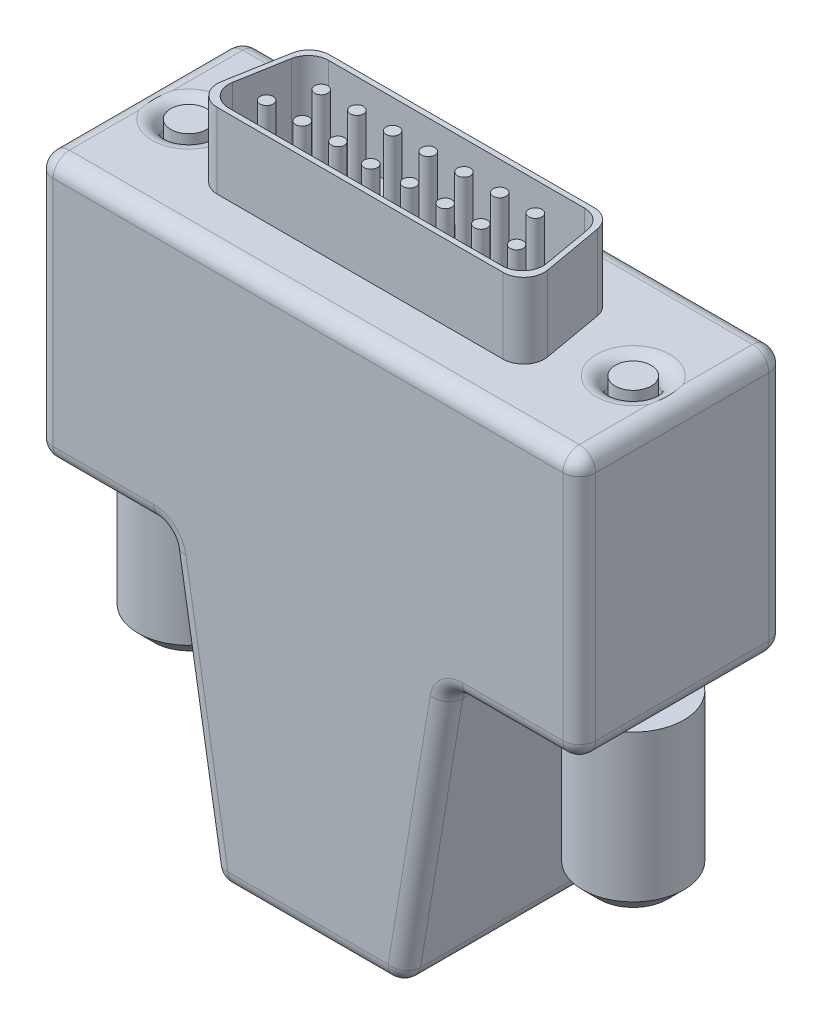
from build123d import *

# Parameters (mm, degrees)
BASE_EXTRUDE_DEPTH  = 8.001
SKETCH10_R          = 1.5875
CUT_EXTRUDE1_DEPTH  = 49.039082516
FILLET2_R           = 1.27
SKETCH13_R          = 2.794
CUT_EXTRUDE4_DEPTH  = 2.54
SKETCH14_R          = 2.54
BOSS_EXTRUDE1_DEPTH = 2.54
SKETCH16_R          = 2.54
BOSS_EXTRUDE2_DEPTH = 2.54
SKETCH17_R          = 1.397
BOSS_EXTRUDE3_DEPTH = 3.81
SKETCH15_R          = 3.937
BOSS_EXTRUDE4_DEPTH = 12.7
CHAMFER1_SIZE       = 1.27
SKETCH18_R          = 1.905
CUT_EXTRUDE5_DEPTH  = 2.54
BOSS_EXTRUDE5_DEPTH = 5.842
SKETCH20_R          = 0.508
BOSS_EXTRUDE6_DEPTH = 5.715
BOSS_EXTRUDE7_START = 16.129
SKETCH23_R          = 1.397
BOSS_EXTRUDE7_DEPTH = 16.129


with BuildPart() as part:
    # Sketch1 → Base-Extrude (new, symmetric)
    with BuildSketch(Plane.XY):
        Polygon((-21.082, 21.209), (21.082, 21.209), (21.082, 0.635), (10.922, 0.635), (7.3025, -21.209), (-7.3025, -21.209), (-10.922, 0.635), (-21.082, 0.635), align=None)
    extrude(amount=BASE_EXTRUDE_DEPTH, both=True)

    # Sketch10 → Cut-Extrude1 (cut, through all)
    with BuildSketch(Plane(origin=(0, 21.209, 0), x_dir=(-1, 0, 0), z_dir=(0, 1, 0))):
        with Locations((17.272, 0)):
            Circle(SKETCH10_R)
        with Locations((-17.272, 0)):
            Circle(SKETCH10_R)
    extrude(amount=-CUT_EXTRUDE1_DEPTH, mode=Mode.SUBTRACT)

    # Fillet2
    # the kernel refuses this fillet: 1.27 mm, written as the material it adds along each edge
    with BuildSketch(Plane(origin=(10.922, 0.635, 8.001), x_dir=(1, 0, 0), z_dir=(0, 0, -1)), Plane(origin=(-10.922, 0.635, -8.001), x_dir=(-1, 0, 0), z_dir=(0, 0, 1))) as fillet2_piece_1:
        with BuildLine():
            CenterArc((FILLET2_R * 0.847937229927, FILLET2_R), FILLET2_R, 189.408295086, 80.591704914)
            Line((-FILLET2_R * 0.138611275568, FILLET2_R * 0.836531206938), (0, 0))
            Line((0, 0), (FILLET2_R * 0.847937229927, 0))
        make_face()
    extrude(amount=16.002)
    # the kernel refuses this fillet: 1.27 mm, written as the material it takes off along each edge
    with BuildSketch(Plane(origin=(-19.812, 19.939, 6.731), x_dir=(-1, 0, 0), z_dir=(0, 1, 0))) as fillet2_2_piece_1_section:
        Polygon((0, 0), (FILLET2_R, 0), (FILLET2_R, FILLET2_R), (0, FILLET2_R), align=None)
    fillet2_2_piece_1 = extrude(amount=FILLET2_R, mode=Mode.PRIVATE)
    fillet2_2_piece_1 = fillet2_2_piece_1 - Plane(origin=(-19.812, 19.939, 6.731), x_dir=(0.7071067811865475, 0, -0.7071067811865475), z_dir=(0, 1, 0)) * Sphere(FILLET2_R, mode=Mode.PRIVATE)
    add(fillet2_2_piece_1, mode=Mode.SUBTRACT)
    with BuildSketch(Plane(origin=(19.812, 19.939, 6.731), x_dir=(0, 0, 1), z_dir=(0, 1, 0))) as fillet2_2_piece_2_section:
        Polygon((0, 0), (FILLET2_R, 0), (FILLET2_R, FILLET2_R), (0, FILLET2_R), align=None)
    fillet2_2_piece_2 = extrude(amount=FILLET2_R, mode=Mode.PRIVATE)
    fillet2_2_piece_2 = fillet2_2_piece_2 - Plane(origin=(19.812, 19.939, 6.731), x_dir=(-0.7071067811865475, 0, -0.7071067811865475), z_dir=(0, 1, 0)) * Sphere(FILLET2_R, mode=Mode.PRIVATE)
    add(fillet2_2_piece_2, mode=Mode.SUBTRACT)
    with BuildSketch(Plane(origin=(19.812, 19.939, -6.731), x_dir=(0, 0, -1), z_dir=(0, 1, 0))) as fillet2_2_piece_3_section:
        Polygon((0, 0), (FILLET2_R, 0), (FILLET2_R, -FILLET2_R), (0, -FILLET2_R), align=None)
    fillet2_2_piece_3 = extrude(amount=FILLET2_R, mode=Mode.PRIVATE)
    fillet2_2_piece_3 = fillet2_2_piece_3 - Plane(origin=(19.812, 19.939, -6.731), x_dir=(-0.7071067811865475, 0, 0.7071067811865475), z_dir=(0, 1, 0)) * Sphere(FILLET2_R, mode=Mode.PRIVATE)
    add(fillet2_2_piece_3, mode=Mode.SUBTRACT)
    with BuildSketch(Plane(origin=(19.812, 1.905, -6.731), x_dir=(0, 0, -1), z_dir=(0, -1, 0))) as fillet2_2_piece_4_section:
        Polygon((0, 0), (FILLET2_R, 0), (FILLET2_R, FILLET2_R), (0, FILLET2_R), align=None)
    fillet2_2_piece_4 = extrude(amount=FILLET2_R, mode=Mode.PRIVATE)
    fillet2_2_piece_4 = fillet2_2_piece_4 - Plane(origin=(19.812, 1.905, -6.731), x_dir=(-0.7071067811865475, 0, 0.7071067811865475), z_dir=(0, -1, 0)) * Sphere(FILLET2_R, mode=Mode.PRIVATE)
    add(fillet2_2_piece_4, mode=Mode.SUBTRACT)
    with BuildSketch(Plane(origin=(-19.812, 1.905, 6.731), x_dir=(0, 0, 1), z_dir=(-1, 0, 0))) as fillet2_2_piece_5_section:
        Polygon((0, 0), (FILLET2_R, 0), (FILLET2_R, -FILLET2_R), (0, -FILLET2_R), align=None)
    fillet2_2_piece_5 = extrude(amount=FILLET2_R, mode=Mode.PRIVATE)
    fillet2_2_piece_5 = fillet2_2_piece_5 - Plane(origin=(-19.812, 1.905, 6.731), x_dir=(0, 0.7071067811865475, -0.7071067811865475), z_dir=(-1, 0, 0)) * Sphere(FILLET2_R, mode=Mode.PRIVATE)
    add(fillet2_2_piece_5, mode=Mode.SUBTRACT)
    with BuildSketch(Plane(origin=(6.225619718, -19.939, 6.731), x_dir=(0.9865485054952676, -0.1634687930617159, 0), z_dir=(0, 0, 1))) as fillet2_2_piece_6_section:
        Polygon((0, 0), (FILLET2_R, 0), (FILLET2_R, -FILLET2_R * 0.847937229927), (FILLET2_R * 0.163468793062, -FILLET2_R * 0.986548505495), align=None)
    fillet2_2_piece_6 = extrude(amount=FILLET2_R, mode=Mode.PRIVATE)
    fillet2_2_piece_6 = fillet2_2_piece_6 - Plane(origin=(6.225619718, -19.939, 6.731), x_dir=(-0.6467345695640075, 0.7627151476998855, 0), z_dir=(0, 0, 1)) * Sphere(FILLET2_R, mode=Mode.PRIVATE)
    add(fillet2_2_piece_6, mode=Mode.SUBTRACT)
    with BuildSketch(Plane(origin=(6.225619718, -19.939, -6.731), x_dir=(0.9865485054952676, -0.1634687930617159, 0), z_dir=(0, 0, -1))) as fillet2_2_piece_7_section:
        Polygon((0, 0), (FILLET2_R, 0), (FILLET2_R, FILLET2_R * 0.847937229927), (FILLET2_R * 0.163468793062, FILLET2_R * 0.986548505495), align=None)
    fillet2_2_piece_7 = extrude(amount=FILLET2_R, mode=Mode.PRIVATE)
    fillet2_2_piece_7 = fillet2_2_piece_7 - Plane(origin=(6.225619718, -19.939, -6.731), x_dir=(-0.6467345695640075, 0.7627151476998855, 0), z_dir=(0, 0, -1)) * Sphere(FILLET2_R, mode=Mode.PRIVATE)
    add(fillet2_2_piece_7, mode=Mode.SUBTRACT)
    with BuildSketch(Plane(origin=(-6.225619718, -19.939, 6.731), x_dir=(0, -1, 0), z_dir=(0, 0, 1))) as fillet2_2_piece_8_section:
        Polygon((0, 0), (FILLET2_R, 0), (FILLET2_R, -FILLET2_R * 0.847937229927), (FILLET2_R * 0.163468793062, -FILLET2_R * 0.986548505495), align=None)
    fillet2_2_piece_8 = extrude(amount=FILLET2_R, mode=Mode.PRIVATE)
    fillet2_2_piece_8 = fillet2_2_piece_8 - Plane(origin=(-6.225619718, -19.939, 6.731), x_dir=(0.6467345695640078, 0.7627151476998854, 0), z_dir=(0, 0, 1)) * Sphere(FILLET2_R, mode=Mode.PRIVATE)
    add(fillet2_2_piece_8, mode=Mode.SUBTRACT)
    with BuildSketch(Plane(origin=(-6.225619718, -19.939, -6.731), x_dir=(0, -1, 0), z_dir=(0, 0, -1))) as fillet2_2_piece_9_section:
        Polygon((0, 0), (FILLET2_R, 0), (FILLET2_R, FILLET2_R * 0.847937229927), (FILLET2_R * 0.163468793062, FILLET2_R * 0.986548505495), align=None)
    fillet2_2_piece_9 = extrude(amount=FILLET2_R, mode=Mode.PRIVATE)
    fillet2_2_piece_9 = fillet2_2_piece_9 - Plane(origin=(-6.225619718, -19.939, -6.731), x_dir=(0.6467345695640078, 0.7627151476998854, 0), z_dir=(0, 0, -1)) * Sphere(FILLET2_R, mode=Mode.PRIVATE)
    add(fillet2_2_piece_9, mode=Mode.SUBTRACT)
    with BuildSketch(Plane(origin=(-19.812, 1.905, -6.731), x_dir=(0, 0, -1), z_dir=(-1, 0, 0))) as fillet2_2_piece_10_section:
        Polygon((0, 0), (FILLET2_R, 0), (FILLET2_R, FILLET2_R), (0, FILLET2_R), align=None)
    fillet2_2_piece_10 = extrude(amount=FILLET2_R, mode=Mode.PRIVATE)
    fillet2_2_piece_10 = fillet2_2_piece_10 - Plane(origin=(-19.812, 1.905, -6.731), x_dir=(0, 0.7071067811865475, 0.7071067811865475), z_dir=(-1, 0, 0)) * Sphere(FILLET2_R, mode=Mode.PRIVATE)
    add(fillet2_2_piece_10, mode=Mode.SUBTRACT)
    with BuildSketch(Plane(origin=(-19.812, 19.939, -6.731), x_dir=(-1, 0, 0), z_dir=(0, 1, 0))) as fillet2_2_piece_11_section:
        Polygon((0, 0), (FILLET2_R, 0), (FILLET2_R, -FILLET2_R), (0, -FILLET2_R), align=None)
    fillet2_2_piece_11 = extrude(amount=FILLET2_R, mode=Mode.PRIVATE)
    fillet2_2_piece_11 = fillet2_2_piece_11 - Plane(origin=(-19.812, 19.939, -6.731), x_dir=(0.7071067811865475, 0, 0.7071067811865475), z_dir=(0, 1, 0)) * Sphere(FILLET2_R, mode=Mode.PRIVATE)
    add(fillet2_2_piece_11, mode=Mode.SUBTRACT)
    with BuildSketch(Plane(origin=(19.812, 1.905, 6.731), x_dir=(0, 0, 1), z_dir=(0, -1, 0))) as fillet2_2_piece_12_section:
        Polygon((0, 0), (FILLET2_R, 0), (FILLET2_R, -FILLET2_R), (0, -FILLET2_R), align=None)
    fillet2_2_piece_12 = extrude(amount=FILLET2_R, mode=Mode.PRIVATE)
    fillet2_2_piece_12 = fillet2_2_piece_12 - Plane(origin=(19.812, 1.905, 6.731), x_dir=(-0.7071067811865475, 0, -0.7071067811865475), z_dir=(0, -1, 0)) * Sphere(FILLET2_R, mode=Mode.PRIVATE)
    add(fillet2_2_piece_12, mode=Mode.SUBTRACT)
    with BuildSketch(Plane(origin=(-19.812, 21.209, 8.001), x_dir=(0, 0, -1), z_dir=(1, 0, 0))) as fillet2_2_piece_13:
        with BuildLine():
            CenterArc((FILLET2_R, -FILLET2_R), FILLET2_R, 90, 90)
            Line((0, -FILLET2_R), (0, 0))
            Line((0, 0), (FILLET2_R, 0))
        make_face()
    extrude(amount=39.624, mode=Mode.SUBTRACT)
    with BuildSketch(Plane(origin=(21.082, 19.939, -8.001), x_dir=(-1, 0, 0), z_dir=(0, -1, 0)), Plane(origin=(-21.082, 1.905, 8.001), x_dir=(0, 0, -1), z_dir=(0, 1, 0))) as fillet2_2_piece_14:
        with BuildLine():
            CenterArc((FILLET2_R, -FILLET2_R), FILLET2_R, 90, 90)
            Line((0, -FILLET2_R), (0, 0))
            Line((0, 0), (FILLET2_R, 0))
        make_face()
    extrude(amount=18.034, mode=Mode.SUBTRACT)
    with BuildSketch(Plane(origin=(19.812, 0.635, -8.001), x_dir=(0, 1, 0), z_dir=(-1, 0, 0)), Plane(origin=(-11.998880282, 0.635, -8.001), x_dir=(0, 1, 0), z_dir=(-1, 0, 0))) as fillet2_2_piece_15:
        with BuildLine():
            CenterArc((FILLET2_R, -FILLET2_R), FILLET2_R, 90, 90)
            Line((0, -FILLET2_R), (0, 0))
            Line((0, 0), (FILLET2_R, 0))
        make_face()
    extrude(amount=7.813119718, mode=Mode.SUBTRACT)
    with BuildSketch(Plane(origin=(7.3025, -21.209, 6.731), x_dir=(0.16346879306171674, 0.9865485054952674, 0), z_dir=(0, 0, -1)), Plane(origin=(-7.3025, -21.209, 6.731), x_dir=(1, 0, 0), z_dir=(0, 0, -1))) as fillet2_2_piece_16:
        with BuildLine():
            CenterArc((FILLET2_R * 0.847937229927, -FILLET2_R), FILLET2_R, 90, 80.591704914)
            Line((-FILLET2_R * 0.138611275568, -FILLET2_R * 0.836531206938), (0, 0))
            Line((0, 0), (FILLET2_R * 0.847937229927, 0))
        make_face()
    extrude(amount=13.462, mode=Mode.SUBTRACT)
    with BuildSketch(Plane(origin=(-21.082, 0.635, -6.731), x_dir=(0, 1, 0), z_dir=(0, 0, 1)), Plane(origin=(-21.082, 21.209, -6.731), x_dir=(1, 0, 0), z_dir=(0, 0, 1)), Plane(origin=(21.082, 21.209, 6.731), x_dir=(-1, 0, 0), z_dir=(0, 0, -1)), Plane(origin=(21.082, 0.635, 6.731), x_dir=(0, 1, 0), z_dir=(0, 0, -1))) as fillet2_2_piece_17:
        with BuildLine():
            CenterArc((FILLET2_R, -FILLET2_R), FILLET2_R, 90, 90)
            Line((0, -FILLET2_R), (0, 0))
            Line((0, 0), (FILLET2_R, 0))
        make_face()
    extrude(amount=13.462, mode=Mode.SUBTRACT)
    with BuildSketch(Plane(origin=(-11.998880282, 0.635, 8.001), x_dir=(0, 1, 0), z_dir=(-1, 0, 0)), Plane(origin=(19.812, 0.635, 8.001), x_dir=(0, 1, 0), z_dir=(-1, 0, 0))) as fillet2_2_piece_18:
        with BuildLine():
            CenterArc((FILLET2_R, FILLET2_R), FILLET2_R, 180, 90)
            Line((0, FILLET2_R), (0, 0))
            Line((0, 0), (FILLET2_R, 0))
        make_face()
    extrude(amount=7.813119718, mode=Mode.SUBTRACT)
    with BuildSketch(Plane(origin=(-7.47853632, -20.146605367, 8.001), x_dir=(0.9865485054952676, 0.16346879306171572, 0), z_dir=(-0.16346879306171572, 0.9865485054952676, 0)), Plane(origin=(10.74596368, -0.427394633, 8.001), x_dir=(-0.9865485054952676, 0.16346879306171594, 0), z_dir=(-0.1634687930617159, -0.9865485054952676, 0))) as fillet2_2_piece_19:
        with BuildLine():
            CenterArc((FILLET2_R, FILLET2_R), FILLET2_R, 180, 90)
            Line((0, FILLET2_R), (0, 0))
            Line((0, 0), (FILLET2_R, 0))
        make_face()
    extrude(amount=19.988080287, mode=Mode.SUBTRACT)
    with BuildSketch(Plane(origin=(6.225619718, -21.209, 8.001), x_dir=(0, 1, 0), z_dir=(-1, 0, 0))) as fillet2_2_piece_20:
        with BuildLine():
            CenterArc((FILLET2_R, FILLET2_R), FILLET2_R, 180, 90)
            Line((0, FILLET2_R), (0, 0))
            Line((0, 0), (FILLET2_R, 0))
        make_face()
    extrude(amount=12.451239436, mode=Mode.SUBTRACT)
    with BuildSketch(Plane(origin=(-17.272, 0.635, 0), x_dir=(-1, 0, 0), z_dir=(0, 0, -1))) as fillet2_2_piece_21:
        with BuildLine():
            CenterArc((1.5875 + FILLET2_R, FILLET2_R), FILLET2_R, 180, 90)
            Line((1.5875 + FILLET2_R, 0), (1.5875, 0))
            Line((1.5875, 0), (1.5875, FILLET2_R))
        make_face()
    revolve(axis=Axis((-17.272, 0.635, 0), (0, 1, 0)), mode=Mode.SUBTRACT)
    with BuildSketch(Plane(origin=(-17.272, 21.209, 0), x_dir=(-1, 0, 0), z_dir=(0, 0, -1))) as fillet2_2_piece_22:
        with BuildLine():
            CenterArc((1.5875 + FILLET2_R, -FILLET2_R), FILLET2_R, 90, 90)
            Line((1.5875, -FILLET2_R), (1.5875, 0))
            Line((1.5875, 0), (1.5875 + FILLET2_R, 0))
        make_face()
    revolve(axis=Axis((-17.272, 21.209, 0), (0, 1, 0)), mode=Mode.SUBTRACT)
    with BuildSketch(Plane(origin=(17.272, 0.635, 0), x_dir=(-1, 0, 0), z_dir=(0, 0, -1))) as fillet2_2_piece_23:
        with BuildLine():
            CenterArc((1.5875 + FILLET2_R, FILLET2_R), FILLET2_R, 180, 90)
            Line((1.5875 + FILLET2_R, 0), (1.5875, 0))
            Line((1.5875, 0), (1.5875, FILLET2_R))
        make_face()
    revolve(axis=Axis((17.272, 0.635, 0), (0, 1, 0)), mode=Mode.SUBTRACT)
    with BuildSketch(Plane(origin=(17.272, 21.209, 0), x_dir=(-1, 0, 0), z_dir=(0, 0, -1))) as fillet2_2_piece_24:
        with BuildLine():
            CenterArc((1.5875 + FILLET2_R, -FILLET2_R), FILLET2_R, 90, 90)
            Line((1.5875, -FILLET2_R), (1.5875, 0))
            Line((1.5875, 0), (1.5875 + FILLET2_R, 0))
        make_face()
    revolve(axis=Axis((17.272, 21.209, 0), (0, 1, 0)), mode=Mode.SUBTRACT)
    with BuildSketch(Plane(origin=(21.082, 19.939, 8.001), x_dir=(-1, 0, 0), z_dir=(0, -1, 0)), Plane(origin=(-21.082, 1.905, -8.001), x_dir=(0, 0, 1), z_dir=(0, 1, 0))) as fillet2_2_piece_25:
        with BuildLine():
            CenterArc((FILLET2_R, FILLET2_R), FILLET2_R, 180, 90)
            Line((0, FILLET2_R), (0, 0))
            Line((0, 0), (FILLET2_R, 0))
        make_face()
    extrude(amount=18.034, mode=Mode.SUBTRACT)
    with BuildSketch(Plane(origin=(10.74596368, -0.427394633, -8.001), x_dir=(-0.9865485054952676, 0.16346879306171594, 0), z_dir=(-0.1634687930617159, -0.9865485054952676, 0)), Plane(origin=(-7.47853632, -20.146605367, -8.001), x_dir=(0.9865485054952676, 0.16346879306171572, 0), z_dir=(-0.16346879306171572, 0.9865485054952676, 0))) as fillet2_2_piece_26:
        with BuildLine():
            CenterArc((FILLET2_R, -FILLET2_R), FILLET2_R, 90, 90)
            Line((0, -FILLET2_R), (0, 0))
            Line((0, 0), (FILLET2_R, 0))
        make_face()
    extrude(amount=19.988080287, mode=Mode.SUBTRACT)
    with BuildSketch(Plane(origin=(6.225619718, -21.209, -8.001), x_dir=(0, 1, 0), z_dir=(-1, 0, 0))) as fillet2_2_piece_27:
        with BuildLine():
            CenterArc((FILLET2_R, -FILLET2_R), FILLET2_R, 90, 90)
            Line((0, -FILLET2_R), (0, 0))
            Line((0, 0), (FILLET2_R, 0))
        make_face()
    extrude(amount=12.451239436, mode=Mode.SUBTRACT)
    with BuildSketch(Plane(origin=(-19.812, 21.209, -8.001), x_dir=(0, 0, 1), z_dir=(1, 0, 0))) as fillet2_2_piece_28:
        with BuildLine():
            CenterArc((FILLET2_R, FILLET2_R), FILLET2_R, 180, 90)
            Line((0, FILLET2_R), (0, 0))
            Line((0, 0), (FILLET2_R, 0))
        make_face()
    extrude(amount=39.624, mode=Mode.SUBTRACT)
    with BuildSketch(Plane(origin=(-11.998880282, -0.635, -8.001), x_dir=(0, 1, 0), z_dir=(-1, 0, 0))) as fillet2_2_piece_29:
        with BuildLine():
            CenterArc((1.27 + FILLET2_R, -FILLET2_R), FILLET2_R, 90, 90)
            Line((1.27, -FILLET2_R), (1.27, 0))
            Line((1.27, 0), (1.27 + FILLET2_R, 0))
        make_face()
    revolve(axis=Axis((-11.998880282, -0.635, -8.001), (0, 0, -1)), revolution_arc=80.591704914, mode=Mode.SUBTRACT)
    with BuildSketch(Plane(origin=(11.998880282, -0.635, -8.001), x_dir=(0, 1, 0), z_dir=(1, 0, 0))) as fillet2_2_piece_30:
        with BuildLine():
            CenterArc((1.27 + FILLET2_R, FILLET2_R), FILLET2_R, 180, 90)
            Line((1.27, FILLET2_R), (1.27, 0))
            Line((1.27, 0), (1.27 + FILLET2_R, 0))
        make_face()
    revolve(axis=Axis((11.998880282, -0.635, -8.001), (0, 0, 1)), revolution_arc=80.591704914, mode=Mode.SUBTRACT)
    with BuildSketch(Plane(origin=(11.998880282, -0.635, 8.001), x_dir=(0, 1, 0), z_dir=(1, 0, 0))) as fillet2_2_piece_31:
        with BuildLine():
            CenterArc((1.27 + FILLET2_R, -FILLET2_R), FILLET2_R, 90, 90)
            Line((1.27, -FILLET2_R), (1.27, 0))
            Line((1.27, 0), (1.27 + FILLET2_R, 0))
        make_face()
    revolve(axis=Axis((11.998880282, -0.635, 8.001), (0, 0, 1)), revolution_arc=80.591704914, mode=Mode.SUBTRACT)
    with BuildSketch(Plane(origin=(-11.998880282, -0.635, 8.001), x_dir=(0, 1, 0), z_dir=(-1, 0, 0))) as fillet2_2_piece_32:
        with BuildLine():
            CenterArc((1.27 + FILLET2_R, FILLET2_R), FILLET2_R, 180, 90)
            Line((1.27, FILLET2_R), (1.27, 0))
            Line((1.27, 0), (1.27 + FILLET2_R, 0))
        make_face()
    revolve(axis=Axis((-11.998880282, -0.635, 8.001), (0, 0, -1)), revolution_arc=80.591704914, mode=Mode.SUBTRACT)

    # Sketch13 → Cut-Extrude4 (cut)
    with BuildSketch(Plane(origin=(0, -21.209, 0), x_dir=(-1, 0, 0), z_dir=(0, 1, 0))):
        with Locations(Location((0, 0, 0), (0, 0, 90))):
            Circle(SKETCH13_R)
    extrude(amount=CUT_EXTRUDE4_DEPTH, mode=Mode.SUBTRACT)

    # Sketch14 → Boss-Extrude1 (add)
    with BuildSketch(Plane.XZ.offset(18.669)):
        with Locations(Location((0, 0, 0), (0, 0, 90))):
            Circle(SKETCH14_R)
    extrude(amount=BOSS_EXTRUDE1_DEPTH)

    # Sketch16 → Boss-Extrude2 (add)
    with BuildSketch(Plane(origin=(0, 5.08, 0), x_dir=(-1, 0, 0), z_dir=(0, 1, 0))):
        with Locations((-17.272, 0)):
            Circle(SKETCH16_R)
        with Locations((17.272, 0)):
            Circle(SKETCH16_R)
    extrude(amount=-BOSS_EXTRUDE2_DEPTH)

    # Sketch17 → Boss-Extrude3 (add)
    with BuildSketch(Plane.XZ.offset(-2.54)):
        with Locations(Location((17.272, 0, 0), (0, 0, 90))):
            Circle(SKETCH17_R)
        with Locations(Location((-17.272, 0, 0), (0, 0, 90))):
            Circle(SKETCH17_R)
    extrude(amount=BOSS_EXTRUDE3_DEPTH)

    # Sketch15 → Boss-Extrude4 (add)
    with BuildSketch(Plane(origin=(0, 0, 0), x_dir=(1, 0, 0), z_dir=(0, 1, 0))):
        with Locations(Location((17.272, 0, 0), (0, 0, 270))):
            Circle(SKETCH15_R)
        with Locations(Location((-17.272, 0, 0), (0, 0, 270))):
            Circle(SKETCH15_R)
    extrude(amount=-BOSS_EXTRUDE4_DEPTH)

    # Chamfer1
    chamfer1_edges = [part.edges().sort_by_distance(p)[0] for p in [
        (17.272, -12.7, -3.937),
        (-17.272, -12.7, -3.937),
    ]]
    chamfer(chamfer1_edges, length=CHAMFER1_SIZE)

    # Sketch18 → Cut-Extrude5 (cut)
    with BuildSketch(Plane.XZ.offset(12.7)):
        with Locations(Location((17.272, 0, 0), (0, 0, 270))):
            Circle(SKETCH18_R)
        with Locations(Location((-17.272, 0, 0), (0, 0, 270))):
            Circle(SKETCH18_R)
    extrude(amount=-CUT_EXTRUDE5_DEPTH, mode=Mode.SUBTRACT)

    # Sketch21 → Boss-Extrude5 (add)
    with BuildSketch(Plane(origin=(0, 21.209, 0), x_dir=(-1, 0, 0), z_dir=(0, 1, 0))):
        with BuildLine():
            Line((-11.10791852, 3.9497), (11.108870634, 3.9497))
            ThreePointArc((11.108870634, 3.9497), (12.334694952, 3.378088733), (12.68476, 2.071628186))
            Line((12.68476, 2.071628186), (11.856199518, -2.627371814))
            ThreePointArc((11.856199518, -2.627371814), (11.308898884, -3.575324318), (10.280310151, -3.9497))
            Line((10.280310151, -3.9497), (-10.279358038, -3.9497))
            ThreePointArc((-10.279358038, -3.9497), (-11.307946771, -3.575324318), (-11.855247404, -2.627371814))
            Line((-11.855247404, -2.627371814), (-12.683807886, 2.071628186))
            ThreePointArc((-12.683807886, 2.071628186), (-12.333742838, 3.378088733), (-11.10791852, 3.9497))
        make_face()
        with BuildLine():
            Line((9.939300061, -3.5433), (-9.938347948, -3.5433))
            ThreePointArc((-9.938347948, -3.5433), (-10.966936681, -3.168924318), (-11.514237314, -2.220971814))
            Line((-11.514237314, -2.220971814), (-12.199479226, 1.665228186))
            ThreePointArc((-12.199479226, 1.665228186), (-11.849414178, 2.971688733), (-10.62358986, 3.5433))
            Line((-10.62358986, 3.5433), (10.624541974, 3.5433))
            ThreePointArc((10.624541974, 3.5433), (11.850366291, 2.971688733), (12.20043134, 1.665228186))
            Line((12.20043134, 1.665228186), (11.515189428, -2.220971814))
            ThreePointArc((11.515189428, -2.220971814), (10.967888794, -3.168924318), (9.939300061, -3.5433))
        make_face(mode=Mode.SUBTRACT)
    extrude(amount=BOSS_EXTRUDE5_DEPTH)

    # Sketch20 → Boss-Extrude6 (add)
    with BuildSketch(Plane(origin=(-1.473588342, 21.209, 0.235386885), x_dir=(-1, 0, 0), z_dir=(0, 1, 0))):
        with Locations((0, 1.4224)):
            Circle(SKETCH20_R)
        with Locations(Location((-2.7813, 1.187013115, 0), (0, 0, 180))):
            Circle(SKETCH20_R)
        with Locations(Location((8.32866, 1.187013115, 0), (0, 0, 180))):
            Circle(SKETCH20_R)
        with Locations(Location((-8.32866, 1.187013115, 0), (0, 0, 180))):
            Circle(SKETCH20_R)
        with Locations(Location((5.55498, 1.187013115, 0), (0, 0, 180))):
            Circle(SKETCH20_R)
        with Locations(Location((-11.10234, 1.187013115, 0), (0, 0, 180))):
            Circle(SKETCH20_R)
        with Locations(Location((2.7813, 1.187013115, 0), (0, 0, 180))):
            Circle(SKETCH20_R)
        with Locations(Location((-5.55498, 1.187013115, 0), (0, 0, 180))):
            Circle(SKETCH20_R)
        with Locations(Location((-9.7155, -1.657786885, 0), (0, 0, 180))):
            Circle(SKETCH20_R)
        with Locations((6.92658, -1.657786885)):
            Circle(SKETCH20_R)
        with Locations(Location((-6.94182, -1.657786885, 0), (0, 0, 180))):
            Circle(SKETCH20_R)
        with Locations((4.1529, -1.657786885)):
            Circle(SKETCH20_R)
        with Locations(Location((-4.16814, -1.657786885, 0), (0, 0, 180))):
            Circle(SKETCH20_R)
        with Locations((1.37922, -1.657786885)):
            Circle(SKETCH20_R)
        with Locations(Location((-1.39446, -1.657786885, 0), (0, 0, 180))):
            Circle(SKETCH20_R)
    extrude(amount=BOSS_EXTRUDE6_DEPTH)

    # Sketch23 → Boss-Extrude7 (add)
    with BuildSketch(Plane(origin=(0, 5.08, 0), x_dir=(-1, 0, 0), z_dir=(0, 1, 0)).offset(BOSS_EXTRUDE7_START)):
        with Locations(Location((17.272, 0, 0), (0, 0, 90))):
            Circle(SKETCH23_R)
        with Locations(Location((-17.272, 0, 0), (0, 0, 90))):
            Circle(SKETCH23_R)
    extrude(amount=-BOSS_EXTRUDE7_DEPTH)


solid = part.part
